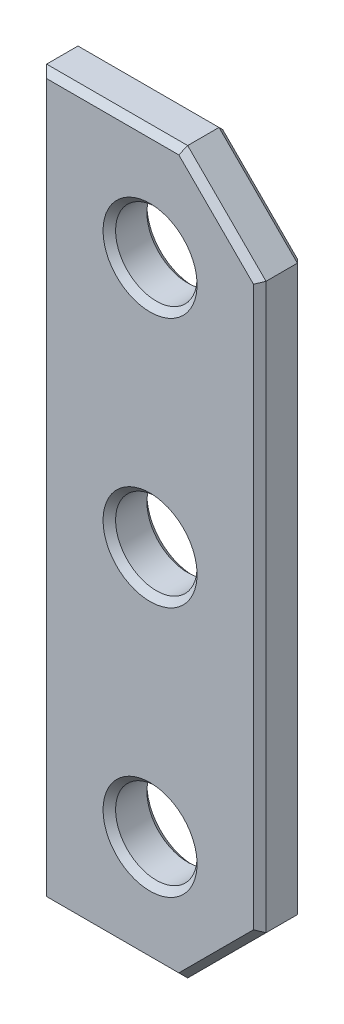
from build123d import *

# Parameters (mm, degrees)
SKETCH_1_R        = 13
EXTRUDE_408_DEPTH = 14
CHAMFER_1_SIZE    = 2


with BuildPart() as part:
    # 草图1 → Extrude 408 (new body)
    with BuildSketch(Plane.XY):
        Polygon((0, 0), (45, 0), (70, 25), (70, 205), (45, 230), (0, 230), align=None)
        with Locations((35, 35)):
            Circle(SKETCH_1_R, mode=Mode.SUBTRACT)
        with Locations((35, 115)):
            Circle(SKETCH_1_R, mode=Mode.SUBTRACT)
        with Locations((35, 195)):
            Circle(SKETCH_1_R, mode=Mode.SUBTRACT)
    extrude(amount=EXTRUDE_408_DEPTH)

    # 倒角1
    chamfer_1_edges = [part.edges().sort_by_distance(p)[0] for p in [
        (22, 195, 0),
        (22, 35, 0),
        (22.5, 0, 0),
        (57.5, 12.5, 0),
        (70, 115, 0),
        (57.5, 217.5, 0),
        (22.5, 230, 0),
        (0, 115, 0),
        (22, 115, 0),
        (22, 195, 14),
        (22, 35, 14),
        (22.5, 230, 14),
        (57.5, 217.5, 14),
        (70, 115, 14),
        (57.5, 12.5, 14),
        (22.5, 0, 14),
        (0, 115, 14),
        (22, 115, 14),
    ]]
    chamfer(chamfer_1_edges, length=CHAMFER_1_SIZE)


solid = part.part
